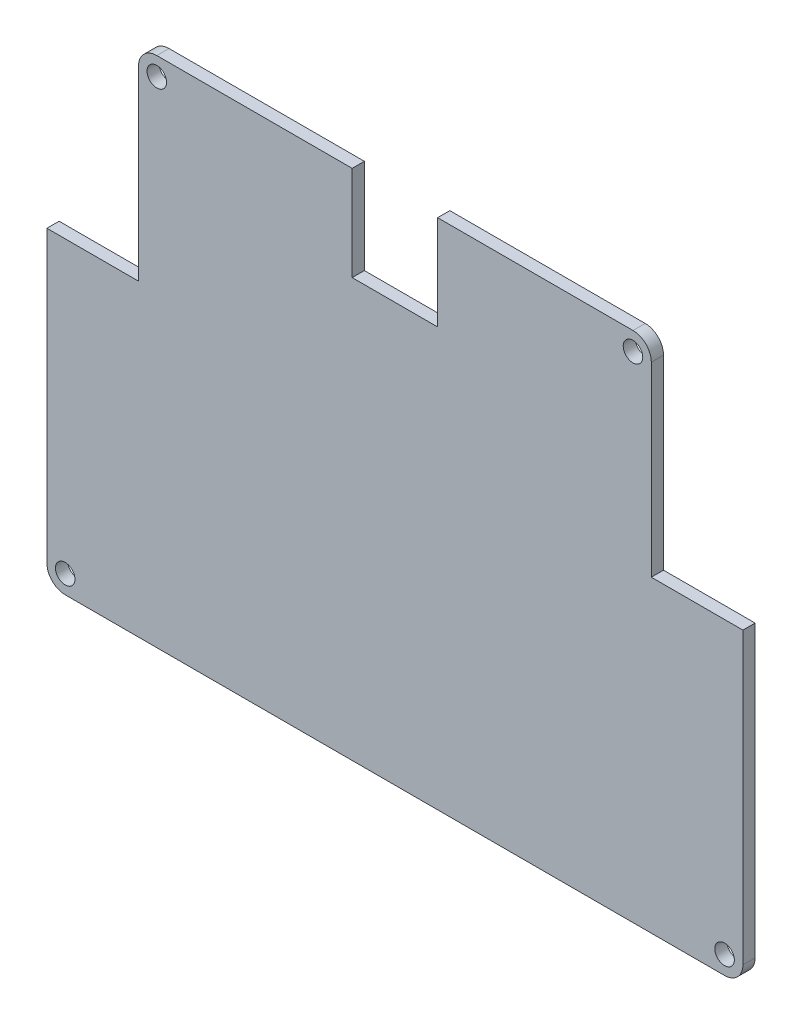
from build123d import *

# Parameters (mm, degrees)
SKETCH1_R           = 1.6
BOSS_EXTRUDE1_DEPTH = 2


with BuildPart() as part:
    # Sketch1 → Boss-Extrude1 (new body)
    with BuildSketch(Plane.XY):
        with BuildLine():
            Line((-42, 25.469603275), (-57, 25.469603275))
            Line((-57, 25.469603275), (-57, -22.030396725))
            ThreePointArc((-57, -22.030396725), (-56.121320344, -24.151717068), (-54, -25.030396725))
            Line((-54, -25.030396725), (54, -25.030396725))
            ThreePointArc((54, -25.030396725), (56.121320344, -24.151717068), (57, -22.030396725))
            Line((57, -22.030396725), (57, 25.469603275))
            Line((57, 25.469603275), (42, 25.469603275))
            Line((42, 25.469603275), (42, 55.969603275))
            ThreePointArc((42, 55.969603275), (41.121320344, 58.090923619), (39, 58.969603275))
            Line((39, 58.969603275), (7, 58.969603275))
            Line((7, 58.969603275), (7, 43.469603275))
            Line((7, 43.469603275), (-7, 43.469603275))
            Line((-7, 43.469603275), (-7, 58.969603275))
            Line((-7, 58.969603275), (-39, 58.969603275))
            ThreePointArc((-39, 58.969603275), (-41.121320344, 58.090923619), (-42, 55.969603275))
            Line((-42, 55.969603275), (-42, 25.469603275))
        make_face()
        with Locations((54, -22.030396725)):
            Circle(SKETCH1_R, mode=Mode.SUBTRACT)
        with Locations((-54, -22.030396725)):
            Circle(SKETCH1_R, mode=Mode.SUBTRACT)
        with Locations((39, 55.969603275)):
            Circle(SKETCH1_R, mode=Mode.SUBTRACT)
        with Locations((-39, 55.969603275)):
            Circle(SKETCH1_R, mode=Mode.SUBTRACT)
    extrude(amount=BOSS_EXTRUDE1_DEPTH)


solid = part.part
